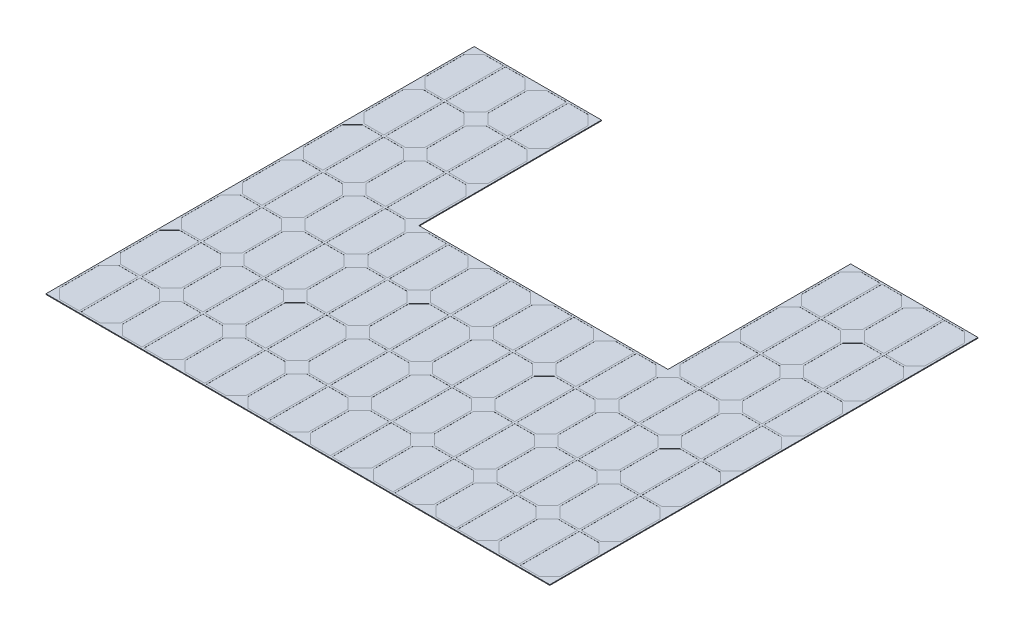
from build123d import *

# Parameters (mm, degrees)
BOSS_EXTRUDE1_DEPTH  = 1
CUT_EXTRUDE1_DEPTH   = 0.11
LPATTERN1_COUNT      = 8
LPATTERN1_PITCH      = 85
LPATTERN1_COUNT_DIR2 = 7
LPATTERN1_PITCH_DIR2 = 82.5


with BuildPart() as part:
    # Sketch1 → Boss-Extrude1 (new body)
    with BuildSketch(Plane(origin=(0, 0, 0), x_dir=(1, 0, 0), z_dir=(0, 1, 0))):
        Polygon((-102.057823129, 273.282312925), (-102.057823129, 25.782312925), (235.442176871, 25.782312925), (235.442176871, 273.282312925), (407.942176871, 273.282312925), (407.942176871, -306.717687075), (-274.557823129, -306.717687075), (-274.557823129, 273.282312925), align=None)
    extrude(amount=BOSS_EXTRUDE1_DEPTH)

    # Sketch2 → Cut-Extrude1 (cut)
    with BuildSketch(Plane(origin=(0, 1, 0), x_dir=(1, 0, 0), z_dir=(0, 1, 0))):
        Polygon((-272.057823129, -237.717687075), (-272.057823129, -290.717687075), (-258.557823129, -304.217687075), (-232.057823129, -304.217687075), (-232.057823129, -224.217687075), (-258.557823129, -224.217687075), align=None)
        Polygon((-203.057823129, -224.217687075), (-189.557823129, -237.717687075), (-189.557823129, -290.717687075), (-203.057823129, -304.217687075), (-229.557823129, -304.217687075), (-229.557823129, -224.217687075), align=None)
    cut_extrude1 = extrude(amount=-CUT_EXTRUDE1_DEPTH, mode=Mode.SUBTRACT)

    # LPattern1: Cut-Extrude1 8 × 7
    with Locations(*[(i * LPATTERN1_PITCH, 0, -j * LPATTERN1_PITCH_DIR2) for i in range(LPATTERN1_COUNT) for j in range(LPATTERN1_COUNT_DIR2) if (i, j) != (0, 0)]):
        add(cut_extrude1, mode=Mode.SUBTRACT)


solid = part.part
